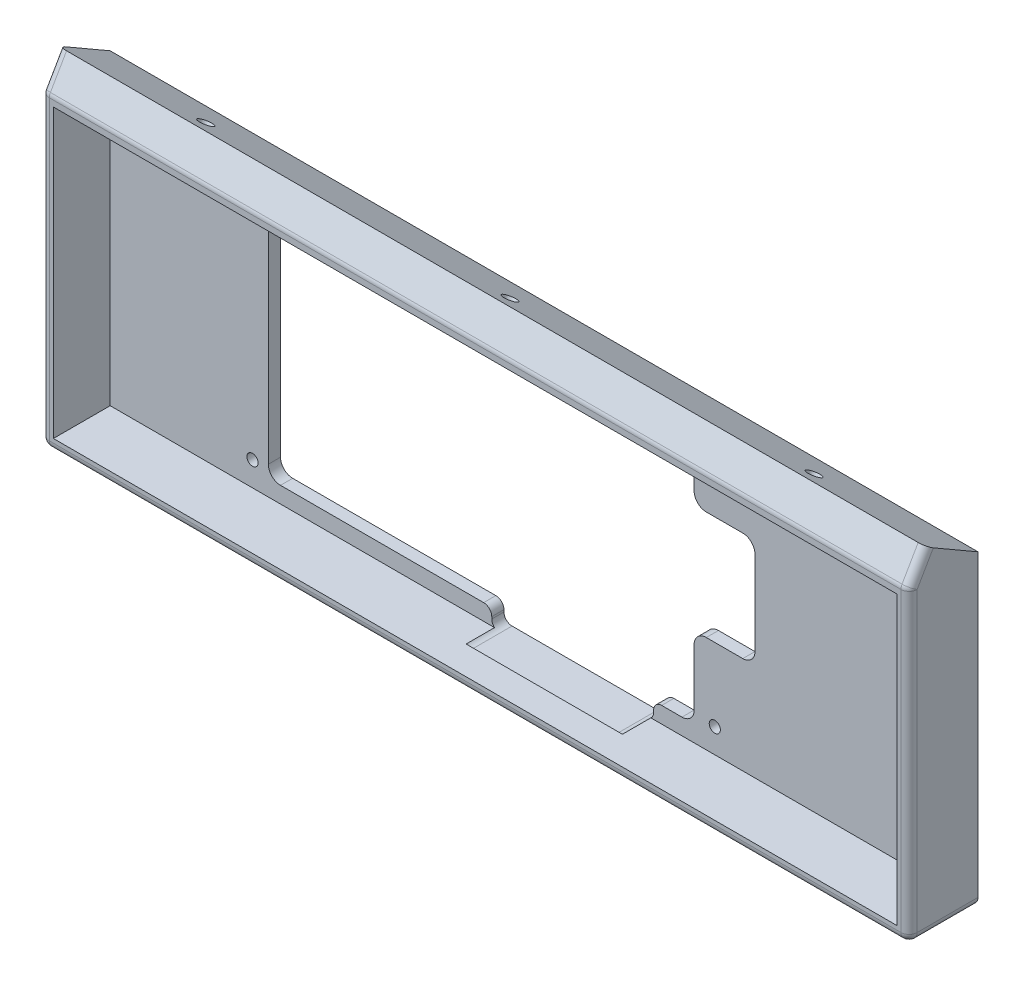
from build123d import *

# Parameters (mm, degrees)
SKETCH1_W               = 214
SKETCH1_H               = 75.8
BOSS_EXTRUDE1_DEPTH     = 17
BOSSEXTENTION_DEPTH     = 214
SHELLIT_T               = -3
SKETCH7_W               = 208
SKETCH7_H               = 4
CUT_EXTRUDE4_DEPTH      = 3
SKETCH3_R               = 1.375
MOUNTING_HOLES_DEPTH    = 1479.493115905
PI_HOLE_DEPTH           = 8
CHAMFER1_START          = 8
CHAMFER1_DEPTH          = 2
CHAMFER1_START_2        = -970
CHAMFER1_2_DEPTH        = 1.564999152
FILLET1_R               = 2
SKETCH11_R              = 1.7
CUT_EXTRUDE5_DEPTH      = 893.868694268
CUT_EXTRUDE6_DEPTH      = 893.868694268
CUT_EXTRUDE6_DEPTH_BACK = 1
SKETCH12_R              = 2.75


with BuildPart() as part:
    # Sketch1 → Boss-Extrude1 (new body)
    with BuildSketch(Plane.XY):
        with Locations((466.705697041, -1324.673912477)):
            Rectangle(SKETCH1_W, SKETCH1_H)
    extrude(amount=BOSS_EXTRUDE1_DEPTH)

    # Sketch6 → BossExtention (add)
    with BuildSketch(Plane(origin=(573.705697041, 0, 0), x_dir=(0, 0, -1), z_dir=(1, 0, 0))):
        Polygon((-17, -1286.773912477), (-12.75, -1279.412696544), (0, -1286.773912477), align=None)
    extrude(amount=-BOSSEXTENTION_DEPTH)

    # Shellit
    shellit_openings = [part.faces().sort_by_distance(p)[0] for p in [
        (466.705697041, -1324.673912477, 17),
    ]]
    offset(amount=SHELLIT_T, openings=shellit_openings, kind=Kind.INTERSECTION)

    # Sketch7 → Cut-Extrude4 (cut)
    with BuildSketch(Plane.XY.offset(17)):
        with Locations((466.705697041, -1290.773912477)):
            Rectangle(SKETCH7_W, SKETCH7_H)
    extrude(amount=-CUT_EXTRUDE4_DEPTH, mode=Mode.SUBTRACT)

    # Sketch3 → Mounting Holes (cut, through all)
    with BuildSketch(Plane.XY.offset(3)):
        with Locations((397.805697041, -1294.473912477)):
            Circle(SKETCH3_R)
        with Locations((511.805697041, -1294.473912477)):
            Circle(SKETCH3_R)
        with Locations((397.805697041, -1353.573912477)):
            Circle(SKETCH3_R)
        with Locations((511.805697041, -1353.573912477)):
            Circle(SKETCH3_R)
    extrude(amount=-MOUNTING_HOLES_DEPTH, mode=Mode.SUBTRACT)

    # Sketch4 → PI_Hole (cut)
    with BuildSketch(Plane(origin=(0, 0, 0), x_dir=(-1, 0, 0), z_dir=(0, 0, -1))):
        with BuildLine():
            Line((-404.705697041, -1355.573912477), (-454.805697041, -1355.573912477))
            ThreePointArc((-454.805697041, -1355.573912477), (-456.219910604, -1356.159698914), (-456.805697041, -1357.573912477))
            Line((-456.805697041, -1357.573912477), (-456.805697041, -1358.073912477))
            ThreePointArc((-456.805697041, -1358.073912477), (-457.391483479, -1359.488126039), (-458.805697041, -1360.073912477))
            Line((-458.805697041, -1360.073912477), (-494.705697041, -1360.073912477))
            ThreePointArc((-494.705697041, -1360.073912477), (-496.119910604, -1359.488126039), (-496.705697041, -1358.073912477))
            Line((-496.705697041, -1358.073912477), (-496.705697041, -1357.573912477))
            ThreePointArc((-496.705697041, -1357.573912477), (-497.291483479, -1356.159698914), (-498.705697041, -1355.573912477))
            Line((-498.705697041, -1355.573912477), (-503.705697041, -1355.573912477))
            ThreePointArc((-503.705697041, -1355.573912477), (-505.827017385, -1354.69523282), (-506.705697041, -1352.573912477))
            Line((-506.705697041, -1352.573912477), (-506.705697041, -1338.573912477))
            ThreePointArc((-506.705697041, -1338.573912477), (-507.584376698, -1336.452592133), (-509.705697041, -1335.573912477))
            Line((-509.705697041, -1335.573912477), (-518.705697041, -1335.573912477))
            ThreePointArc((-518.705697041, -1335.573912477), (-520.827017385, -1334.69523282), (-521.705697041, -1332.573912477))
            Line((-521.705697041, -1332.573912477), (-521.705697041, -1311.773912477))
            ThreePointArc((-521.705697041, -1311.773912477), (-520.827017385, -1309.652592133), (-518.705697041, -1308.773912477))
            Line((-518.705697041, -1308.773912477), (-509.705697041, -1308.773912477))
            ThreePointArc((-509.705697041, -1308.773912477), (-507.584376698, -1307.89523282), (-506.705697041, -1305.773912477))
            Line((-506.705697041, -1305.773912477), (-506.705697041, -1295.773912477))
            ThreePointArc((-506.705697041, -1295.773912477), (-505.827017385, -1293.652592133), (-503.705697041, -1292.773912477))
            Line((-503.705697041, -1292.773912477), (-404.705697041, -1292.773912477))
            ThreePointArc((-404.705697041, -1292.773912477), (-402.584376698, -1293.652592133), (-401.705697041, -1295.773912477))
            Line((-401.705697041, -1295.773912477), (-401.705697041, -1352.573912477))
            ThreePointArc((-401.705697041, -1352.573912477), (-402.584376698, -1354.69523282), (-404.705697041, -1355.573912477))
        make_face()
    extrude(amount=-PI_HOLE_DEPTH, mode=Mode.SUBTRACT)

    # Chamfer1: read off the stored shape, not the designer's step
    # Chamfer1 outline → Chamfer1 (cut)
    with BuildSketch(Plane.XY.offset(CHAMFER1_START)):
        with BuildLine():
            ThreePointArc((457.482821386, -1359.573912477), (458.09859026, -1359.94474117), (458.805697041, -1360.073912477))
            Line((458.805697041, -1360.073912477), (494.705697041, -1360.073912477))
            ThreePointArc((494.705697041, -1360.073912477), (495.412803822, -1359.94474117), (496.028572697, -1359.573912477))
            Line((496.028572697, -1359.573912477), (457.482821386, -1359.573912477))
        make_face()
    extrude(amount=CHAMFER1_DEPTH, mode=Mode.SUBTRACT)

    # Chamfer1 2 outline → Chamfer1 2 (add)
    with BuildSketch(Plane(origin=(0, 0, 0), x_dir=(1, 0, 0), z_dir=(0, 0.70710678118655, -0.707106781186545)).offset(CHAMFER1_START_2)):
        with BuildLine():
            Line((494.705697041, 954.999972006), (458.805697041, 954.999972006))
            add(Edge.make_bspline(
                [(458.805697041, 954.999972006), (458.049768095, 954.999972006), (457.482821386, 954.292865225)],
                knots=[0, 0, 0, 0.722734248, 0.722734248, 0.722734248], degree=2, weights=[1, 0.935414347, 1]))
            Line((457.482821386, 954.292865225), (496.028572697, 954.292865225))
            add(Edge.make_bspline(
                [(496.028572697, 954.292865225), (495.461625987, 954.999972006), (494.705697041, 954.999972006)],
                knots=[5.560451059, 5.560451059, 5.560451059, 6.283185307, 6.283185307, 6.283185307], degree=2, weights=[1, 0.935414347, 1]))
        make_face()
    extrude(amount=CHAMFER1_2_DEPTH)

    # Fillet1
    fillet1_edges = [part.edges().sort_by_distance(p)[0] for p in [
        (359.705697041, -1324.673912477, 17),
        (573.705697041, -1283.09330451, 14.875),
        (359.705697041, -1283.09330451, 14.875),
        (466.705697041, -1362.573912477, 17),
        (573.705697041, -1324.673912477, 17),
        (573.705697041, -1362.573912477, 8.5),
        (359.705697041, -1362.573912477, 8.5),
        (466.705697041, -1286.773912477, 17),
    ]]
    fillet(fillet1_edges, radius=FILLET1_R)

    # Sketch11 → Cut-Extrude5 (cut, through all)
    with BuildSketch(Plane(origin=(0, -967.678510569, 558.689448566), x_dir=(1, 0, 0), z_dir=(0, -0.8660254037844403, 0.499999999999997))):
        with Locations(Location((466.705697041, -633.664524374, 0), (0, 0, 270))):
            Circle(SKETCH11_R)
        with Locations(Location((541.705697041, -633.664524374, 0), (0, 0, 270))):
            Circle(SKETCH11_R)
        with Locations(Location((391.705697041, -633.664524374, 0), (0, 0, 270))):
            Circle(SKETCH11_R)
    extrude(amount=-CUT_EXTRUDE5_DEPTH, mode=Mode.SUBTRACT)

    # Sketch12 → Cut-Extrude6 (cut, two sides: drawn at the far end of the back side and taken through both)
    with BuildSketch(Plane(origin=(0, -967.678510569, 558.689448566), x_dir=(1, 0, 0), z_dir=(0, -0.8660254037844403, 0.499999999999997)).offset(-CUT_EXTRUDE6_DEPTH_BACK)):
        with Locations(Location((391.705697041, -633.664524374, 0), (0, 0, 46.658241773))):
            Circle(SKETCH12_R)
        with Locations(Location((466.705697041, -633.664524374, 0), (0, 0, 46.658241773))):
            Circle(SKETCH12_R)
        with Locations(Location((541.705697041, -633.664524374, 0), (0, 0, 46.658241773))):
            Circle(SKETCH12_R)
    extrude(amount=CUT_EXTRUDE6_DEPTH + CUT_EXTRUDE6_DEPTH_BACK, mode=Mode.SUBTRACT)


solid = part.part
